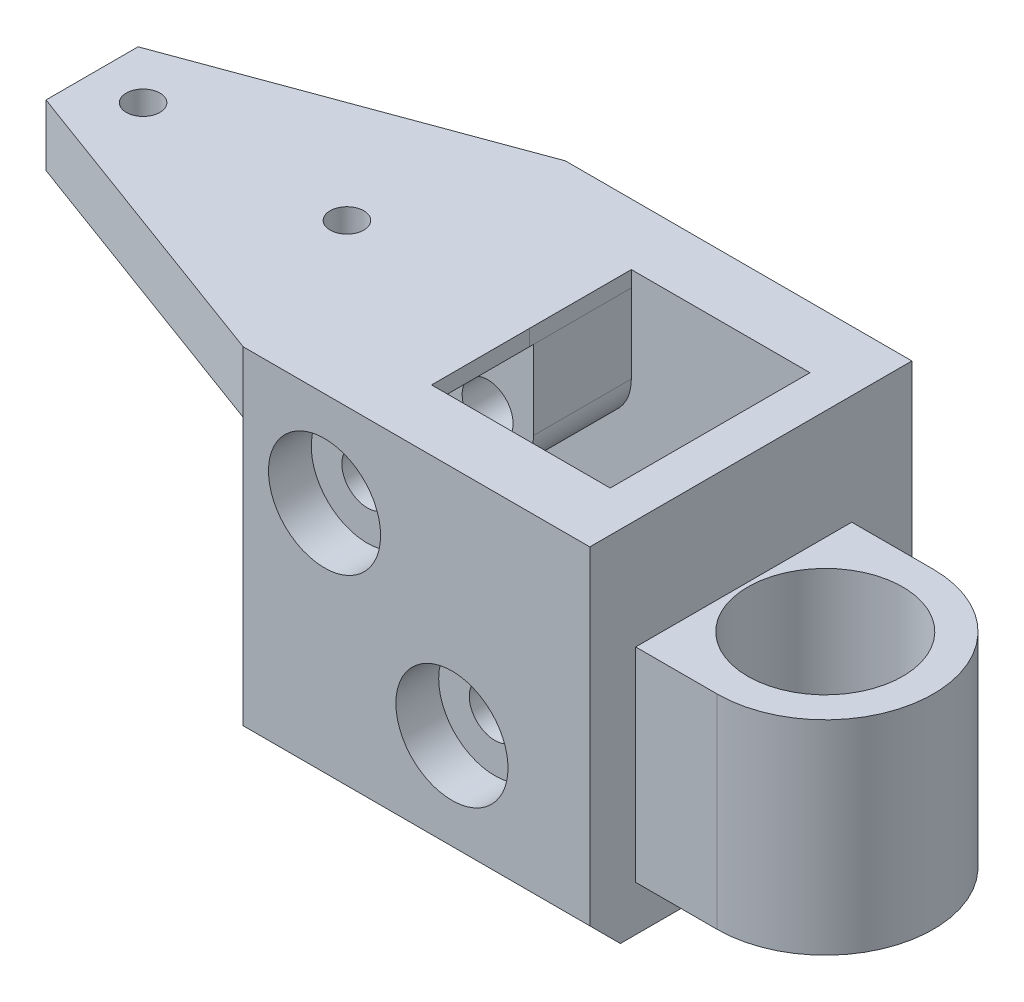
from build123d import *

# Parameters (mm, degrees)
BOSS_EXTRUDE1_START          = -14.449843802
BOSS_EXTRUDE1_DEPTH          = 35.199843802
BOSS_EXTRUDE1_START_2        = 14.75
BOSS_EXTRUDE1_2_OUTLINE_R    = 1.65
BOSS_EXTRUDE1_2_OUTLINE_W    = 9
BOSS_EXTRUDE1_2_OUTLINE_H    = 9.6
BOSS_EXTRUDE1_2_DEPTH        = 6
BOSS_EXTRUDE1_START_3        = -10
BOSS_EXTRUDE1_3_OUTLINE_R    = 7.6
BOSS_EXTRUDE1_3_DEPTH        = 20
BOSS_EXTRUDE1_START_4        = 19.190880057
BOSS_EXTRUDE1_4_DEPTH        = 1.559119943
BOSS_EXTRUDE1_START_5        = 7.5083521
BOSS_EXTRUDE1_5_OUTLINE_W    = 9
BOSS_EXTRUDE1_5_OUTLINE_H    = 9.6
BOSS_EXTRUDE1_5_DEPTH        = 7.2416479
BOSS_EXTRUDE1_START_6        = -14.45
BOSS_EXTRUDE1_6_OUTLINE_W    = 33.999996
BOSS_EXTRUDE1_6_OUTLINE_H    = 6
BOSS_EXTRUDE1_6_DEPTH        = 0.000156198
BOSS_EXTRUDE1_START_7        = 47
BOSS_EXTRUDE1_7_OUTLINE_R    = 1.5
BOSS_EXTRUDE1_7_OUTLINE_R_2  = 2.5
BOSS_EXTRUDE1_7_DEPTH        = 31.6
BOSS_EXTRUDE1_START_8        = 74.4
BOSS_EXTRUDE1_8_OUTLINE_R    = 5.5
BOSS_EXTRUDE1_8_OUTLINE_R_2  = 2.5
BOSS_EXTRUDE1_8_DEPTH        = 4.2
BOSS_EXTRUDE1_START_9        = 53
BOSS_EXTRUDE1_9_OUTLINE_W    = 17.524996
BOSS_EXTRUDE1_9_OUTLINE_H    = 1.559119943
BOSS_EXTRUDE1_9_DEPTH        = 19.6
BOSS_EXTRUDE1_START_10       = 49.8
BOSS_EXTRUDE1_10_OUTLINE_R   = 3
BOSS_EXTRUDE1_10_OUTLINE_R_2 = 1.5
BOSS_EXTRUDE1_10_DEPTH       = 3.2
BOSS_EXTRUDE1_11_DEPTH       = 9.6
BOSS_EXTRUDE1_START_11       = -67
BOSS_EXTRUDE1_12_DEPTH       = 3.325034354
SKETCH2_R                    = 2.5
BOSS_EXTRUDE2_DEPTH          = 6
BOSS_EXTRUDE3_START          = -6
SKETCH3_R                    = 1.5
BOSS_EXTRUDE3_DEPTH          = 6
SKETCH4_R                    = 5.500000377
CUT_EXTRUDE1_DEPTH           = 20
BOSS_EXTRUDE5_START          = -9.6
SKETCH10_R                   = 4.5
SKETCH10_R_2                 = 2.5
BOSS_EXTRUDE5_DEPTH          = 9.6


with BuildPart() as part:
    # Boss-Extrude1: read off the stored shape, not the designer's step
    # Boss-Extrude1 outline → Boss-Extrude1 (new body)
    with BuildSketch(Plane(origin=(0, 0, 0), x_dir=(1, 0, 0), z_dir=(0, 1, 0)).offset(BOSS_EXTRUDE1_START)):
        Polygon((75.650004, -78.6), (109.65, -78.6), (109.65, -47), (75.650004, -47), (75.650004, -53), (105.65, -53), (105.65, -72.6), (75.650004, -72.6), align=None)
    extrude(amount=BOSS_EXTRUDE1_DEPTH)

    # Boss-Extrude1 2 outline → Boss-Extrude1 2 (add)
    # profile 1 of 2: a face of its own
    with BuildSketch(Plane(origin=(0, 0, 0), x_dir=(1, 0, 0), z_dir=(0, 1, 0)).offset(BOSS_EXTRUDE1_START_2)):
        Polygon((45.000000715, -67.299820617), (75.650004, -78.6), (75.650004, -47), (45.000000715, -58.268270649), align=None)
        with Locations((50, -62.775)):
            Circle(BOSS_EXTRUDE1_2_OUTLINE_R, mode=Mode.SUBTRACT)
        with Locations((70, -62.775)):
            Circle(BOSS_EXTRUDE1_2_OUTLINE_R, mode=Mode.SUBTRACT)
    # profile 2 of 2: a face of its own
    with BuildSketch(Plane(origin=(0, 0, 0), x_dir=(1, 0, 0), z_dir=(0, 1, 0)).offset(BOSS_EXTRUDE1_START_2)):
        with Locations((83.624612426, -57.8)):
            Rectangle(BOSS_EXTRUDE1_2_OUTLINE_W, BOSS_EXTRUDE1_2_OUTLINE_H)
    extrude(amount=BOSS_EXTRUDE1_2_DEPTH)

    # Boss-Extrude1 3 outline → Boss-Extrude1 3 (add)
    with BuildSketch(Plane(origin=(0, 0, 0), x_dir=(1, 0, 0), z_dir=(0, 1, 0)).offset(BOSS_EXTRUDE1_START_3)):
        with BuildLine():
            Line((109.65, -52.9), (109.65, -74.1))
            Line((109.65, -74.1), (117.650000004, -74.1))
            ThreePointArc((117.650000004, -74.1), (128.250000004, -63.5), (117.650000004, -52.9))
            Line((117.650000004, -52.9), (109.65, -52.9))
        make_face()
        with Locations((117.650000004, -63.5)):
            Circle(BOSS_EXTRUDE1_3_OUTLINE_R, mode=Mode.SUBTRACT)
    extrude(amount=BOSS_EXTRUDE1_3_DEPTH)

    # Boss-Extrude1 4 outline → Boss-Extrude1 4 (add)
    with BuildSketch(Plane(origin=(0, 0, 0), x_dir=(1, 0, 0), z_dir=(0, 1, 0)).offset(BOSS_EXTRUDE1_START_4)):
        Polygon((75.650004, -53), (75.650004, -72.6), (88.124612426, -72.6), (105.65, -72.6), (105.65, -53), (88.125004, -53), (88.124612426, -62.6), (79.124612426, -62.6), (79.124612426, -53), align=None)
    extrude(amount=BOSS_EXTRUDE1_4_DEPTH)

    # Boss-Extrude1 5 outline → Boss-Extrude1 5 (add)
    with BuildSketch(Plane(origin=(0, 0, 0), x_dir=(1, 0, 0), z_dir=(0, 1, 0)).offset(BOSS_EXTRUDE1_START_5)):
        with Locations((83.624612426, -57.8)):
            Rectangle(BOSS_EXTRUDE1_5_OUTLINE_W, BOSS_EXTRUDE1_5_OUTLINE_H)
    extrude(amount=BOSS_EXTRUDE1_5_DEPTH)

    # Boss-Extrude1 6 outline → Boss-Extrude1 6 (add)
    with BuildSketch(Plane(origin=(0, 0, 0), x_dir=(1, 0, 0), z_dir=(0, 1, 0)).offset(BOSS_EXTRUDE1_START_6)):
        with Locations((92.650002, -75.6)):
            Rectangle(BOSS_EXTRUDE1_6_OUTLINE_W, BOSS_EXTRUDE1_6_OUTLINE_H)
        with Locations((92.650002, -50)):
            Rectangle(BOSS_EXTRUDE1_6_OUTLINE_W, BOSS_EXTRUDE1_6_OUTLINE_H)
    extrude(amount=BOSS_EXTRUDE1_6_DEPTH)

    # Boss-Extrude1 7 outline → Boss-Extrude1 7 (cut)
    with BuildSketch(Plane.XY.offset(BOSS_EXTRUDE1_START_7)):
        with Locations((99.15, 5)):
            Circle(BOSS_EXTRUDE1_7_OUTLINE_R)
        with Locations((84.15, -5)):
            Circle(BOSS_EXTRUDE1_7_OUTLINE_R)
        with Locations((84.15, 5)):
            Circle(BOSS_EXTRUDE1_7_OUTLINE_R)
        Polygon((75.650004, -14.45), (78.650004, -14.45), (75.650004, -11.45), align=None)
        with Locations((83.624612426, 11.45)):
            Circle(BOSS_EXTRUDE1_7_OUTLINE_R_2)
        with Locations((96.124244734, -2.05)):
            Circle(BOSS_EXTRUDE1_7_OUTLINE_R_2)
    extrude(amount=BOSS_EXTRUDE1_7_DEPTH, mode=Mode.SUBTRACT)

    # Boss-Extrude1 8 outline → Boss-Extrude1 8 (cut)
    # profile 1 of 2: a face of its own
    with BuildSketch(Plane.XY.offset(BOSS_EXTRUDE1_START_8)):
        with Locations((96.124244734, -2.05)):
            Circle(BOSS_EXTRUDE1_8_OUTLINE_R)
        with Locations((96.124244734, -2.05)):
            Circle(BOSS_EXTRUDE1_8_OUTLINE_R_2, mode=Mode.SUBTRACT)
    # profile 2 of 2: a face of its own
    with BuildSketch(Plane.XY.offset(BOSS_EXTRUDE1_START_8)):
        with BuildLine():
            ThreePointArc((83.017518444, 5.983608421), (84.028220179, 6.495048386), (85.108368282, 6.15391951))
            ThreePointArc((85.108368282, 6.15391951), (83.178086416, 16.93184408), (83.017518444, 5.983608421))
        make_face()
        with Locations((83.624612426, 11.45)):
            Circle(BOSS_EXTRUDE1_8_OUTLINE_R_2, mode=Mode.SUBTRACT)
    extrude(amount=BOSS_EXTRUDE1_8_DEPTH, mode=Mode.SUBTRACT)

    # Boss-Extrude1 9 outline → Boss-Extrude1 9 (cut)
    with BuildSketch(Plane.XY.offset(BOSS_EXTRUDE1_START_9)):
        with BuildLine():
            Line((82.504348232, 7.5083521), (85.795651769, 7.5083521))
            ThreePointArc((85.795651769, 7.5083521), (84.15, 8), (82.504348232, 7.5083521))
        make_face()
        with BuildLine():
            ThreePointArc((88.124612426, 11.45), (87.498865711, 9.160860101), (85.795651769, 7.5083521))
            Line((85.795651769, 7.5083521), (88.124612426, 7.5083521))
            Line((88.124612426, 7.5083521), (88.124612426, 11.45))
        make_face()
        with BuildLine():
            Line((79.124612426, 7.5083521), (81.453573082, 7.5083521))
            ThreePointArc((81.453573082, 7.5083521), (79.75035914, 9.160860101), (79.124612426, 11.45))
            Line((79.124612426, 11.45), (79.124612426, 7.5083521))
        make_face()
        with Locations((96.887502, 19.970440029)):
            Rectangle(BOSS_EXTRUDE1_9_OUTLINE_W, BOSS_EXTRUDE1_9_OUTLINE_H)
    extrude(amount=BOSS_EXTRUDE1_9_DEPTH, mode=Mode.SUBTRACT)

    # Boss-Extrude1 10 outline → Boss-Extrude1 10 (cut)
    # profile 1 of 3: a face of its own
    with BuildSketch(Plane.XY.offset(BOSS_EXTRUDE1_START_10)):
        with Locations((99.15, 5)):
            Circle(BOSS_EXTRUDE1_10_OUTLINE_R)
        with Locations((99.15, 5)):
            Circle(BOSS_EXTRUDE1_10_OUTLINE_R_2, mode=Mode.SUBTRACT)
    # profile 2 of 3: a face of its own
    with BuildSketch(Plane.XY.offset(BOSS_EXTRUDE1_START_10)):
        with Locations((84.15, -5)):
            Circle(BOSS_EXTRUDE1_10_OUTLINE_R)
        with Locations((84.15, -5)):
            Circle(BOSS_EXTRUDE1_10_OUTLINE_R_2, mode=Mode.SUBTRACT)
    # profile 3 of 3: a face of its own
    with BuildSketch(Plane.XY.offset(BOSS_EXTRUDE1_START_10)):
        with Locations((84.15, 5)):
            Circle(BOSS_EXTRUDE1_10_OUTLINE_R)
        with Locations((84.15, 5)):
            Circle(BOSS_EXTRUDE1_10_OUTLINE_R_2, mode=Mode.SUBTRACT)
    extrude(amount=BOSS_EXTRUDE1_10_DEPTH, mode=Mode.SUBTRACT)

    # Boss-Extrude1 11 outline → Boss-Extrude1 11 (add)
    with BuildSketch(Plane.XY.offset(BOSS_EXTRUDE1_START_9)):
        with BuildLine():
            ThreePointArc((81.453573082, 7.5083521), (81.780748633, 7.345104592), (82.120097653, 7.20895823))
            ThreePointArc((82.120097653, 7.20895823), (82.306136207, 7.366467053), (82.504348232, 7.5083521))
            Line((82.504348232, 7.5083521), (81.453573082, 7.5083521))
        make_face()
    extrude(amount=BOSS_EXTRUDE1_11_DEPTH)

    # Boss-Extrude1 12 outline → Boss-Extrude1 12 (cut)
    with BuildSketch(Plane(origin=(0, 0, 0), x_dir=(1, 0, 0), z_dir=(0, 0.707106781186547, -0.707106781186548)).offset(BOSS_EXTRUDE1_START_11)):
        Polygon((75.650004, -47.482220357), (109.65, -47.482220357), (109.65, -43.23957967), (78.650004, -43.23957967), align=None)
    extrude(amount=BOSS_EXTRUDE1_12_DEPTH, mode=Mode.SUBTRACT)

    # Sketch2 → Boss-Extrude2 (add)
    with BuildSketch(Plane(origin=(0, 0, 47), x_dir=(-1, 0, 0), z_dir=(0, 0, -1))):
        Polygon((-75.650004, 20.75), (-109.65, 20.75), (-109.65, -14.45), (-78.650004, -14.45), (-75.650004, -11.45), (-75.650004, 14.75), align=None)
        with Locations((-96.124244734, -2.05)):
            Circle(SKETCH2_R, mode=Mode.SUBTRACT)
        with Locations(Location((-83.624612426, 11.45, 0), (0, 0, 180))):
            Circle(SKETCH2_R, mode=Mode.SUBTRACT)
    extrude(amount=-BOSS_EXTRUDE2_DEPTH)

    # Sketch3 → Boss-Extrude3 (add)
    with BuildSketch(Plane.XY.offset(78.6).offset(BOSS_EXTRUDE3_START)):
        with Locations((84.15, -5)):
            Circle(SKETCH3_R)
        with Locations((84.15, 5)):
            Circle(SKETCH3_R)
        with Locations((99.15, 5)):
            Circle(SKETCH3_R)
    extrude(amount=BOSS_EXTRUDE3_DEPTH)

    # Sketch4 → Cut-Extrude1 (cut)
    with BuildSketch(Plane.XY.offset(74.4)):
        with Locations((83.624611966, 11.45)):
            Circle(SKETCH4_R)
    extrude(amount=CUT_EXTRUDE1_DEPTH, mode=Mode.SUBTRACT)

    # Sketch10 → Boss-Extrude5 (add)
    with BuildSketch(Plane.XY.offset(62.6).offset(BOSS_EXTRUDE5_START)):
        with Locations((83.624612426, 11.45)):
            Circle(SKETCH10_R)
        with Locations((83.624612426, 11.45)):
            Circle(SKETCH10_R_2, mode=Mode.SUBTRACT)
    extrude(amount=BOSS_EXTRUDE5_DEPTH)


solid = part.part
